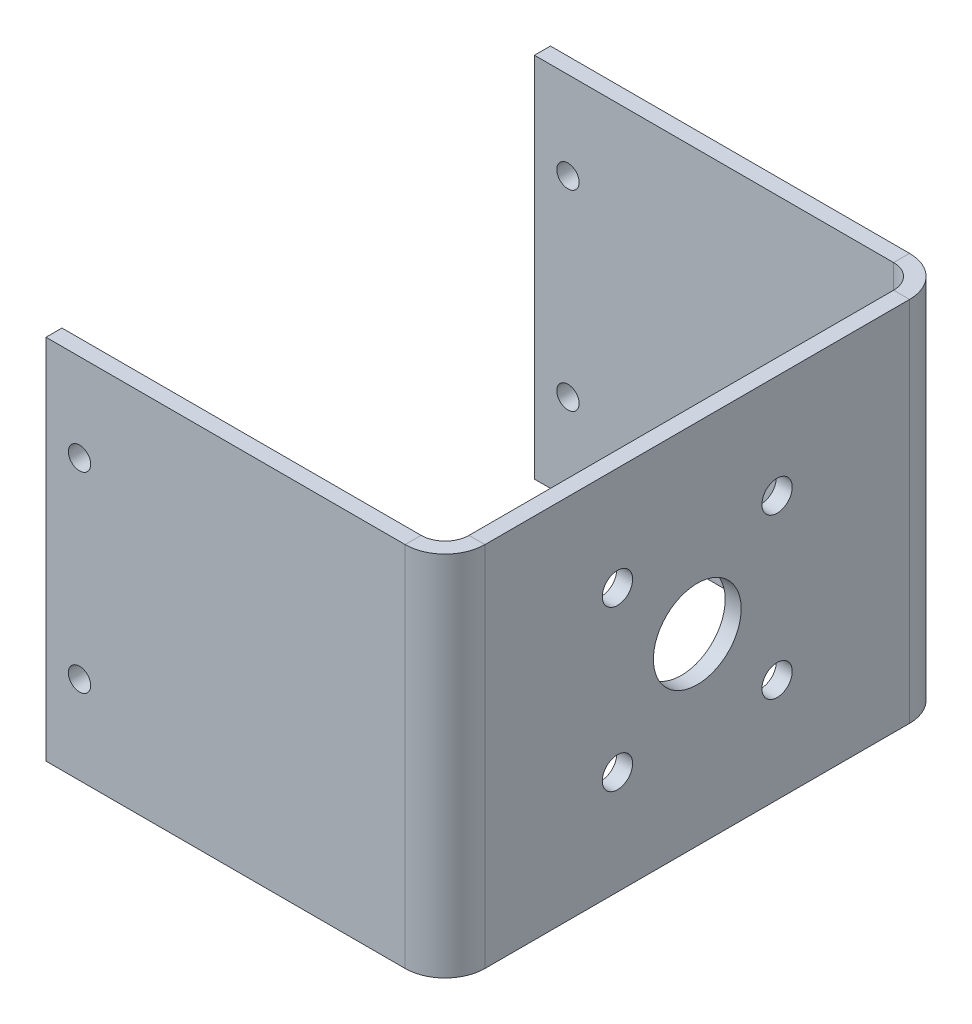
from build123d import *

# Parameters (mm, degrees)
SKETCH1_W                      = 316
SKETCH1_H                      = 230
BASE_FLANGE1_DEPTH             = 10
EDGE_FLANGE1_STRIP_W           = 70
EDGE_FLANGE1_STRIP_H           = 10
EDGE_FLANGE1_STRIP_CUT_DEPTH   = 230
EDGE_FLANGE1_STRIP_2_W         = 70
EDGE_FLANGE1_STRIP_2_H         = 10
EDGE_FLANGE1_STRIP_CUT_2_DEPTH = 230
EDGE_FLANGE1_DEPTH             = 230
EDGE_FLANGE1_BEND_DEPTH        = 230
SKETCH12_R                     = 27.5
CUT_EXTRUDE1_DEPTH             = 10
SKETCH14_R                     = 9.5
CUT_EXTRUDE3_DEPTH             = 10
CIRPATTERN1_COUNT              = 4
SKETCH17_R                     = 7
CUT_EXTRUDE4_DEPTH             = 420.023865669


# Sheet-metal steps are written as plain solids
with BuildPart() as part:
    # Sketch1 → Base-Flange1 (new body)
    with BuildSketch(Plane(origin=(0, 0, 0), x_dir=(0, 0, -1), z_dir=(1, 0, 0))):
        Rectangle(SKETCH1_W, SKETCH1_H)
    extrude(amount=-BASE_FLANGE1_DEPTH)

    # Edge-Flange1 strip (across the edge) → Edge-Flange1 strip cut (cut)
    with BuildSketch(Plane(origin=(-10, -115, 158), x_dir=(0, 0, -1), z_dir=(0, 1, 0))):
        with Locations((-10, -5)):
            Rectangle(EDGE_FLANGE1_STRIP_W, EDGE_FLANGE1_STRIP_H)
    extrude(amount=EDGE_FLANGE1_STRIP_CUT_DEPTH, mode=Mode.SUBTRACT)

    # Edge-Flange1 strip 2 (across the edge) → Edge-Flange1 strip cut 2 (cut)
    with BuildSketch(Plane(origin=(-10, 115, -158), x_dir=(0, 0, 1), z_dir=(0, -1, 0))):
        with Locations((-10, -5)):
            Rectangle(EDGE_FLANGE1_STRIP_2_W, EDGE_FLANGE1_STRIP_2_H)
    extrude(amount=EDGE_FLANGE1_STRIP_CUT_2_DEPTH, mode=Mode.SUBTRACT)

    # Edge-Flange1 section (across the edge) → Edge-Flange1 (add)
    with BuildSketch(Plane(origin=(-10, -115, 158), x_dir=(0, 0, -1), z_dir=(0, 1, 0))):
        with BuildLine():
            Line((0, 15), (0, 240))
            Line((0, 240), (10, 240))
            Line((10, 240), (10, 15))
            ThreePointArc((10, 15), (14.393398282, 4.393398282), (25, 0))
            Line((25, 0), (25, -10))
            ThreePointArc((25, -10), (7.32233047, -2.67766953), (0, 15))
        make_face()
    extrude(amount=EDGE_FLANGE1_DEPTH)

    # Edge-Flange1 section 2 (across the edge) → Edge-Flange1 bend (add)
    with BuildSketch(Plane(origin=(-10, 115, -158), x_dir=(0, 0, 1), z_dir=(0, -1, 0))):
        with BuildLine():
            Line((0, 15), (0, 240))
            Line((0, 240), (10, 240))
            Line((10, 240), (10, 15))
            ThreePointArc((10, 15), (14.393398282, 4.393398282), (25, 0))
            Line((25, 0), (25, -10))
            ThreePointArc((25, -10), (7.32233047, -2.67766953), (0, 15))
        make_face()
    extrude(amount=EDGE_FLANGE1_BEND_DEPTH)

    # Sketch12 → Cut-Extrude1 (cut)
    with BuildSketch(Plane(origin=(0, 0, 0), x_dir=(0, 0, -1), z_dir=(1, 0, 0))):
        Circle(SKETCH12_R)
    extrude(amount=-CUT_EXTRUDE1_DEPTH, mode=Mode.SUBTRACT)

    # Sketch14 → Cut-Extrude3 (cut)
    with BuildSketch(Plane(origin=(0, 0, 0), x_dir=(0, 0, -1), z_dir=(1, 0, 0))):
        with Locations((-50, 50)):
            Circle(SKETCH14_R)
    cut_extrude3 = extrude(amount=-CUT_EXTRUDE3_DEPTH, mode=Mode.SUBTRACT)

    # CirPattern1: Cut-Extrude3 ×4 about axis
    cirpattern1_axis = Axis((0, 0, 0), (1, 0, 0))
    for i in range(1, CIRPATTERN1_COUNT):
        add(cut_extrude3.rotate(cirpattern1_axis, i * 360 / CIRPATTERN1_COUNT), mode=Mode.SUBTRACT)

    # Sketch17 → Cut-Extrude4 (cut, through all)
    with BuildSketch(Plane.XY.offset(158)):
        with Locations((-229, 60)):
            Circle(SKETCH17_R)
        with Locations((-229, -60)):
            Circle(SKETCH17_R)
    extrude(amount=-CUT_EXTRUDE4_DEPTH, mode=Mode.SUBTRACT)


solid = part.part
